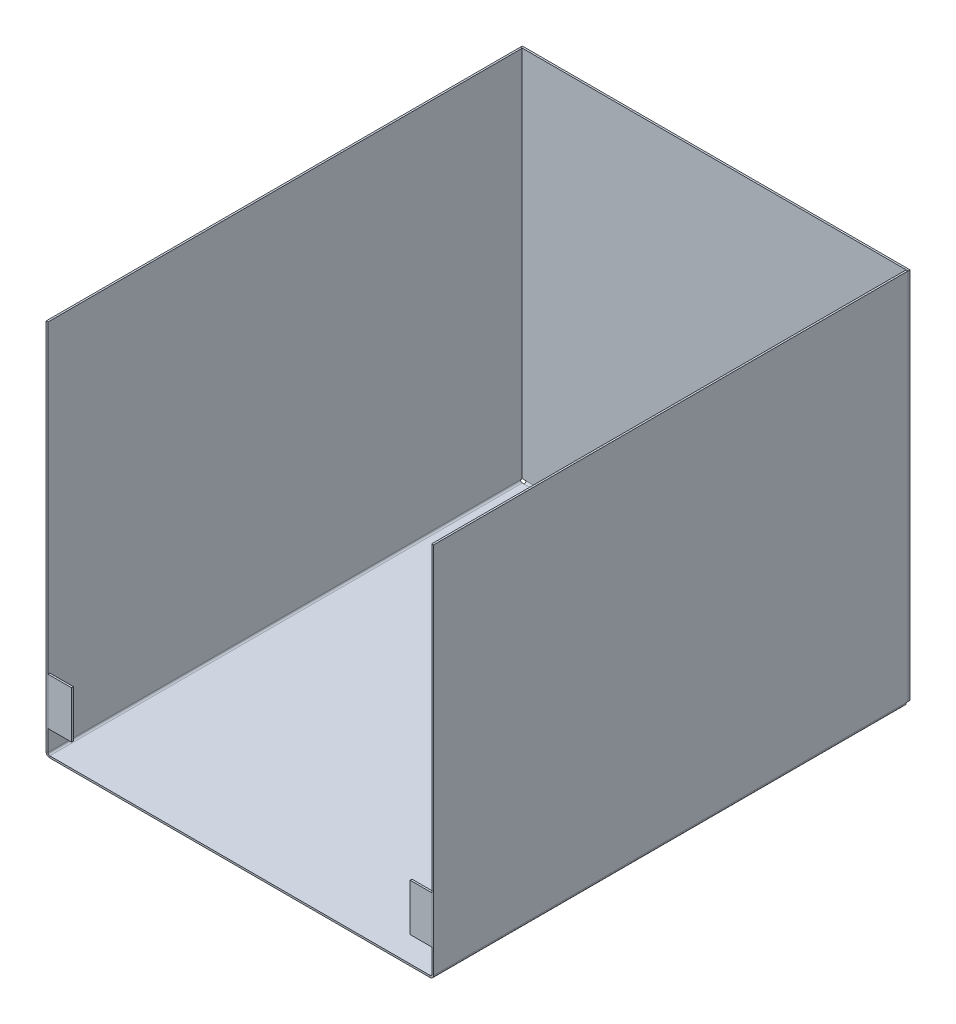
from build123d import *

# Parameters (mm, degrees)
SKETCH1_W                   = 203.2
SKETCH1_H                   = 254
BASE_FLANGE1_DEPTH          = 1
EDGE_FLANGE1_DEPTH          = 203.2
EDGE_FLANGE2_DEPTH          = 255
EDGE_FLANGE3_DEPTH          = 255
CLOSED_START                = -104.6
CLOSED_CORNER13_OUTLINE_W   = 201.2
CLOSED_CORNER13_OUTLINE_H   = 1
CLOSED_CORNER13_DEPTH       = 3
CLOSED_CORNER13_2_OUTLINE_W = 201.2
CLOSED_CORNER13_2_OUTLINE_H = 0.9
CLOSED_CORNER13_2_DEPTH     = 1
CLOSED_START_2              = 101.6
CLOSED_CORNER14_OUTLINE_W   = 201.2
CLOSED_CORNER14_OUTLINE_H   = 1
CLOSED_CORNER14_DEPTH       = 3
CLOSED_START_3              = 103.6
CLOSED_CORNER14_2_OUTLINE_W = 201.2
CLOSED_CORNER14_2_OUTLINE_H = 0.9
CLOSED_CORNER14_2_DEPTH     = 1
SKETCH26_W                  = 12.7
SKETCH26_H                  = 25.4
BASE_FLANGE3_DEPTH          = 1
SKETCH31_W                  = 12.7
SKETCH31_H                  = 25.4
BASE_FLANGE4_DEPTH          = 1


# Read off the part's stored shape, not the designer's step: Closed Corner13, Closed Corner14
# Sheet-metal steps are written as plain solids
with BuildPart() as part:
    # Sketch1 → Base-Flange1 (new body)
    with BuildSketch(Plane(origin=(0, 0, 0), x_dir=(1, 0, 0), z_dir=(0, 1, 0))):
        Rectangle(SKETCH1_W, SKETCH1_H)
    extrude(amount=-BASE_FLANGE1_DEPTH)

    # Edge-Flange1 section (across the edge) → Edge-Flange1 (add)
    with BuildSketch(Plane(origin=(101.6, 0, -130), x_dir=(0, 0, 1), z_dir=(-1, 0, 0))):
        with BuildLine():
            Line((0, 1), (0, 202.2))
            Line((0, 202.2), (1, 202.2))
            Line((1, 202.2), (1, 1))
            ThreePointArc((1, 1), (1.292893219, 0.292893219), (2, 0))
            Line((2, 0), (3, 0))
            Line((3, 0), (3, -1))
            Line((3, -1), (2, -1))
            ThreePointArc((2, -1), (0.585786438, -0.414213562), (0, 1))
        make_face()
    extrude(amount=EDGE_FLANGE1_DEPTH)

    # Edge-Flange2 section (across the edge) → Edge-Flange2 (add)
    with BuildSketch(Plane(origin=(-104.6, 0, -128), x_dir=(1, 0, 0), z_dir=(0, 0, 1))):
        with BuildLine():
            Line((0, 1), (0, 202.2))
            Line((0, 202.2), (1, 202.2))
            Line((1, 202.2), (1, 1))
            ThreePointArc((1, 1), (1.292893219, 0.292893219), (2, 0))
            Line((2, 0), (3, 0))
            Line((3, 0), (3, -1))
            Line((3, -1), (2, -1))
            ThreePointArc((2, -1), (0.585786438, -0.414213562), (0, 1))
        make_face()
    extrude(amount=EDGE_FLANGE2_DEPTH)

    # Edge-Flange3 section (across the edge) → Edge-Flange3 (add)
    with BuildSketch(Plane(origin=(104.6, 0, 127), x_dir=(-1, 0, 0), z_dir=(0, 0, -1))):
        with BuildLine():
            Line((0, 1), (0, 202.2))
            Line((0, 202.2), (1, 202.2))
            Line((1, 202.2), (1, 1))
            ThreePointArc((1, 1), (1.292893219, 0.292893219), (2, 0))
            Line((2, 0), (3, 0))
            Line((3, 0), (3, -1))
            Line((3, -1), (2, -1))
            ThreePointArc((2, -1), (0.585786438, -0.414213562), (0, 1))
        make_face()
    extrude(amount=EDGE_FLANGE3_DEPTH)

    # Closed Corner13 outline → Closed Corner13 (add)
    with BuildSketch(Plane.YZ.offset(CLOSED_START)):
        with Locations((101.6, -129.5)):
            Rectangle(CLOSED_CORNER13_OUTLINE_W, CLOSED_CORNER13_OUTLINE_H)
    extrude(amount=CLOSED_CORNER13_DEPTH)

    # Closed Corner13 2 outline → Closed Corner13 2 (add)
    with BuildSketch(Plane.YZ.offset(CLOSED_START)):
        with Locations((101.6, -128.45)):
            Rectangle(CLOSED_CORNER13_2_OUTLINE_W, CLOSED_CORNER13_2_OUTLINE_H)
    extrude(amount=CLOSED_CORNER13_2_DEPTH)

    # Closed Corner14 outline → Closed Corner14 (add)
    with BuildSketch(Plane.YZ.offset(CLOSED_START_2)):
        with Locations((101.6, -129.5)):
            Rectangle(CLOSED_CORNER14_OUTLINE_W, CLOSED_CORNER14_OUTLINE_H)
    extrude(amount=CLOSED_CORNER14_DEPTH)

    # Closed Corner14 2 outline → Closed Corner14 2 (add)
    with BuildSketch(Plane.YZ.offset(CLOSED_START_3)):
        with Locations((101.6, -128.45)):
            Rectangle(CLOSED_CORNER14_2_OUTLINE_W, CLOSED_CORNER14_2_OUTLINE_H)
    extrude(amount=CLOSED_CORNER14_2_DEPTH)


with BuildPart() as body_2:
    # Sketch26 → Base-Flange3 (new body)
    with BuildSketch(Plane(origin=(104.6, 1, 127), x_dir=(1, 0, 0), z_dir=(0, 0, 1))):
        with Locations((-6.35, 25.4)):
            Rectangle(SKETCH26_W, SKETCH26_H)
    extrude(amount=-BASE_FLANGE3_DEPTH)


with BuildPart() as body_3:
    # Sketch31 → Base-Flange4 (new body)
    with BuildSketch(Plane.XY.offset(127)):
        with Locations((-97.25, 24.985786438)):
            Rectangle(SKETCH31_W, SKETCH31_H)
    extrude(amount=-BASE_FLANGE4_DEPTH)


solid = Compound([part.part, body_2.part, body_3.part])
